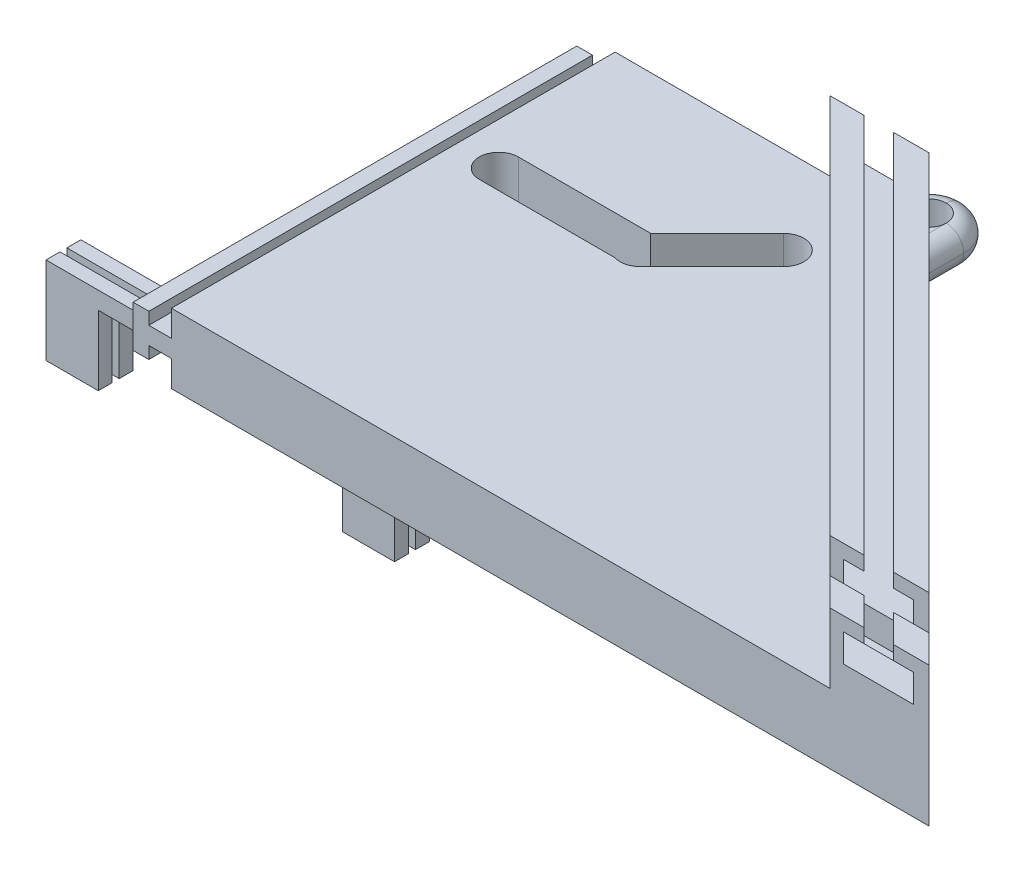
from build123d import *

# Parameters (mm, degrees)
BOSS_EXTRUDE1_DEPTH  = 10
BOSS_EXTRUDE3_DEPTH  = 65
SKETCH3_W            = 6.566984135
SKETCH3_H            = 1.360389693
CUT_EXTRUDE2_DEPTH   = 65
BOSS_EXTRUDE4_DEPTH  = 3.25
BOSS_EXTRUDE5_DEPTH  = 2.25
SKETCH7_W            = 10
SKETCH7_H            = 5
BOSS_EXTRUDE6_DEPTH  = 10
SKETCH8_R            = 2.5
CUT_EXTRUDE3_DEPTH   = 10
FILLET1_R            = 5
FILLET2_R            = 5
FILLET4_R            = 2.5
FILLET5_R            = 2.5
SKETCH9_W            = 100
SKETCH9_H            = 5.5
CUT_EXTRUDE4_DEPTH   = 100
BOSS_EXTRUDE7_DEPTH  = 10
CUT_EXTRUDE5_DEPTH   = 150
SKETCH12_W           = 29.92089387
SKETCH12_H           = 33.203721342
CUT_EXTRUDE6_DEPTH   = 150
SKETCH14_W           = 19.184954217
SKETCH14_H           = 28.132637814
CUT_EXTRUDE7_DEPTH   = 150
SKETCH16_W           = 15.620456736
SKETCH16_H           = 10.822807293
CUT_EXTRUDE8_DEPTH   = 150
CUT_EXTRUDE9_DEPTH   = 10
CUT_EXTRUDE10_DEPTH  = 10
SKETCH19_W           = 10
SKETCH19_H           = 2
SKETCH19_W_2         = 15
BOSS_EXTRUDE9_DEPTH  = 2.5
SKETCH21_W           = 7.5
SKETCH21_H           = 2
BOSS_EXTRUDE10_DEPTH = 10


with BuildPart() as part:
    # Sketch1 → Boss-Extrude1 (new body)
    with BuildSketch(Plane(origin=(0, 0, 0), x_dir=(1, 0, 0), z_dir=(0, 1, 0))):
        Polygon((-11.672910159, -34.563988547), (96.966700148, -34.563988547), (33.327089841, 29.07562176), (-11.672910159, 29.07562176), align=None)
    extrude(amount=BOSS_EXTRUDE1_DEPTH)

    # Sketch2 → Boss-Extrude3 (add)
    with BuildSketch(Plane.XY.offset(34.563988547)):
        Polygon((-11.672910159, 3.75), (-14.922910159, 3.75), (-14.922910159, 2), (-17.172910159, 2), (-17.172910159, 8), (-14.922910159, 8), (-14.922910159, 6.25), (-11.672910159, 6.25), align=None)
    extrude(amount=-BOSS_EXTRUDE3_DEPTH)

    # Sketch3 → Cut-Extrude2 (cut)
    with BuildSketch(Plane(origin=(0, 8, 0), x_dir=(1, 0, 0), z_dir=(0, 1, 0))):
        with Locations((-13.889418092, 29.755816607)):
            Rectangle(SKETCH3_W, SKETCH3_H)
    extrude(amount=-CUT_EXTRUDE2_DEPTH, mode=Mode.SUBTRACT)

    # Sketch4 → Boss-Extrude4 (add)
    with BuildSketch(Plane(origin=(0, 10, 0), x_dir=(1, 0, 0), z_dir=(0, 1, 0))):
        Polygon((91.663399289, -34.563988547), (28.023788982, 29.07562176), (25.520630977, 29.07562176), (89.160241283, -34.563988547), align=None)
    extrude(amount=BOSS_EXTRUDE4_DEPTH)

    # Sketch6 → Boss-Extrude5 (add)
    with BuildSketch(Plane(origin=(0, 13.25, 0), x_dir=(1, 0, 0), z_dir=(0, 1, 0))):
        Polygon((90.411820286, -34.563988547), (94.136820286, -34.563988547), (30.497209979, 29.07562176), (23.047209979, 29.07562176), (86.686820286, -34.563988547), align=None)
    extrude(amount=BOSS_EXTRUDE5_DEPTH)

    # Sketch7 → Boss-Extrude6 (add)
    with BuildSketch(Plane(origin=(0, 0, -29.07562176), x_dir=(-1, 0, 0), z_dir=(0, 0, -1))):
        with Locations((-28.327089841, 5)):
            Rectangle(SKETCH7_W, SKETCH7_H)
    extrude(amount=BOSS_EXTRUDE6_DEPTH)

    # Sketch8 → Cut-Extrude3 (cut)
    with BuildSketch(Plane(origin=(0, 7.5, 0), x_dir=(1, 0, 0), z_dir=(0, 1, 0))):
        with Locations(Location((28.327089841, 34.07562176, 0), (0, 0, 270))):
            Circle(SKETCH8_R)
    extrude(amount=-CUT_EXTRUDE3_DEPTH, mode=Mode.SUBTRACT)

    # Fillet1
    fillet1_edges = [part.edges().sort_by_distance(p)[0] for p in [
        (23.327089841, 5, -39.07562176),
    ]]
    fillet(fillet1_edges, radius=FILLET1_R)

    # Fillet2
    fillet2_edges = [part.edges().sort_by_distance(p)[0] for p in [
        (33.327089841, 5, -39.07562176),
    ]]
    fillet(fillet2_edges, radius=FILLET2_R - 0.0001)  # a hair under: the kernel refuses the full size

    # Fillet4
    fillet4_edges = [part.edges().sort_by_distance(p)[0] for p in [
        (23.327089841, 7.5, -31.57562176),
        (33.327089841, 7.5, -31.57567176),
        (24.791555935, 7.5, -37.611155666),
    ]]
    fillet(fillet4_edges, radius=FILLET4_R - 0.0001)  # a hair under: the kernel refuses the full size

    # Fillet5
    fillet5_edges = [part.edges().sort_by_distance(p)[0] for p in [
        (23.327089841, 2.5, -31.57562176),
        (33.327089841, 2.5, -31.57567176),
        (24.791555935, 2.5, -37.611155666),
        (31.862653036, 2.5, -37.611184955),
    ]]
    fillet(fillet5_edges, radius=FILLET5_R - 0.0001)  # a hair under: the kernel refuses the full size

    # Sketch9 → Cut-Extrude4 (cut)
    with BuildSketch(Plane.XY.offset(34.563988547)):
        with Locations((44.136820286, 12.75)):
            Rectangle(SKETCH9_W, SKETCH9_H)
    extrude(amount=-CUT_EXTRUDE4_DEPTH, mode=Mode.SUBTRACT)

    # Sketch10 → Boss-Extrude7 (add)
    with BuildSketch(Plane(origin=(0, 10, 0), x_dir=(1, 0, 0), z_dir=(0, 1, 0))):
        Polygon((96.966700148, -34.563988547), (89.895632336, -41.635056358), (7.416994707, 40.84358127), (14.488062519, 47.914649082), align=None)
    extrude(amount=BOSS_EXTRUDE7_DEPTH)

    # Sketch11 → Cut-Extrude5 (cut)
    with BuildSketch(Plane(origin=(65.765344347, 0, 65.765344347), x_dir=(0.7071067811865475, 0, -0.7071067811865477), z_dir=(0.7071067811865477, 0, 0.7071067811865475))):
        Polygon((40.542543722, 20), (40.542543722, 18), (42.592543722, 18), (42.592543722, 14), (35.492543722, 14), (35.492543722, 18), (37.542543722, 18), (37.542543722, 20), align=None)
    extrude(amount=-CUT_EXTRUDE5_DEPTH, mode=Mode.SUBTRACT)

    # Sketch12 → Cut-Extrude6 (cut)
    with BuildSketch(Plane(origin=(0, 10, 0), x_dir=(-1, 0, 0), z_dir=(0, -1, 0))):
        with Locations((-34.145401152, 45.677482431)):
            Rectangle(SKETCH12_W, SKETCH12_H)
    extrude(amount=-CUT_EXTRUDE6_DEPTH, mode=Mode.SUBTRACT)


with BuildPart() as cut_extrude6_piece_1:
    # of the separate pieces the step leaves, piece 1, a body of its own (cut_extrude6_pieces)
    add(part.part.solids().sort_by_distance((30.827189841, 2.5, -29.07562176))[0])

    # Sketch16 → Cut-Extrude8 (cut)
    with BuildSketch(Plane(origin=(0, 10, 0), x_dir=(-1, 0, 0), z_dir=(0, -1, 0))):
        with Locations((-90.634792892, -39.975392193)):
            Rectangle(SKETCH16_W, SKETCH16_H)
    extrude(amount=-CUT_EXTRUDE8_DEPTH, mode=Mode.SUBTRACT)

    # Sketch17 → Cut-Extrude9 (cut)
    with BuildSketch(Plane(origin=(0, 20, 0), x_dir=(1, 0, 0), z_dir=(0, 1, 0))):
        Polygon((92.966700148, -30.563988547), (78.824564524, -30.563988547), (73.824564524, -25.563988547), (87.966700148, -25.563988547), align=None)
    extrude(amount=-CUT_EXTRUDE9_DEPTH, mode=Mode.SUBTRACT)

    # Sketch18 → Cut-Extrude10 (cut)
    with BuildSketch(Plane(origin=(0, 10, 0), x_dir=(1, 0, 0), z_dir=(0, 1, 0))):
        with BuildLine():
            Line((27.059004739, 14.493613639), (16.811162643, 4.245771544))
            ThreePointArc((16.811162643, 4.245771544), (12.674223335, 4.245771544), (12.674223335, 8.382710852))
            Line((12.674223335, 8.382710852), (22.92206543, 18.630552948))
            ThreePointArc((22.92206543, 18.630552948), (27.059004739, 18.630552948), (27.059004739, 14.493613639))
        make_face()
        with BuildLine():
            Line((14.742692989, 3.517272066), (-5.595455146, 3.517272066))
            ThreePointArc((-5.595455146, 3.517272066), (-8.392424278, 6.314241198), (-5.595455146, 9.11121033))
            Line((-5.595455146, 9.11121033), (14.742692989, 9.11121033))
            ThreePointArc((14.742692989, 9.11121033), (17.539662121, 6.314241198), (14.742692989, 3.517272066))
        make_face()
    extrude(amount=-CUT_EXTRUDE10_DEPTH, mode=Mode.SUBTRACT)

    # Sketch19 → Boss-Extrude9 (add)
    with BuildSketch(Plane(origin=(0, 0, 0), x_dir=(-1, 0, 0), z_dir=(0, -1, 0))):
        with Locations((-8.327089841, -26.563988547)):
            Rectangle(SKETCH19_W, SKETCH19_H)
        with Locations((-8.327089841, -23.563988547)):
            Rectangle(SKETCH19_W, SKETCH19_H)
        with Locations((31.672910159, -26.563988547)):
            Rectangle(SKETCH19_W, SKETCH19_H)
        with Locations((31.672910159, -23.563988547)):
            Rectangle(SKETCH19_W, SKETCH19_H)
        with Locations((4.172910159, -26.563988547)):
            Rectangle(SKETCH19_W_2, SKETCH19_H)
        with Locations((4.172910159, -23.563988547)):
            Rectangle(SKETCH19_W_2, SKETCH19_H)
        with Locations((19.172910159, -26.563988547)):
            Rectangle(SKETCH19_W_2, SKETCH19_H)
        with Locations((19.172910159, -23.563988547)):
            Rectangle(SKETCH19_W_2, SKETCH19_H)
    extrude(amount=BOSS_EXTRUDE9_DEPTH)

    # Sketch21 → Boss-Extrude10 (add)
    with BuildSketch(Plane(origin=(0, -2.5, 0), x_dir=(-1, 0, 0), z_dir=(0, -1, 0))):
        with Locations((-9.577089841, -23.563988547)):
            Rectangle(SKETCH21_W, SKETCH21_H)
        with Locations((-9.577089841, -26.563988547)):
            Rectangle(SKETCH21_W, SKETCH21_H)
        with Locations((32.922910159, -26.563988547)):
            Rectangle(SKETCH21_W, SKETCH21_H)
        with Locations((32.922910159, -23.563988547)):
            Rectangle(SKETCH21_W, SKETCH21_H)
    extrude(amount=BOSS_EXTRUDE10_DEPTH)


with BuildPart() as cut_extrude6_piece_2:
    # of the separate pieces the step leaves, piece 2, a body of its own (cut_extrude6_pieces)
    add(part.part.solids().sort_by_distance((7.416994707, 10, -40.84358127))[0])

    # Sketch14 → Cut-Extrude7 (cut)
    with BuildSketch(Plane(origin=(0, 10, 0), x_dir=(-1, 0, 0), z_dir=(0, -1, 0))):
        with Locations((-9.592477109, 43.141940667)):
            Rectangle(SKETCH14_W, SKETCH14_H)
    extrude(amount=-CUT_EXTRUDE7_DEPTH, mode=Mode.SUBTRACT)


solid = cut_extrude6_piece_1.part
